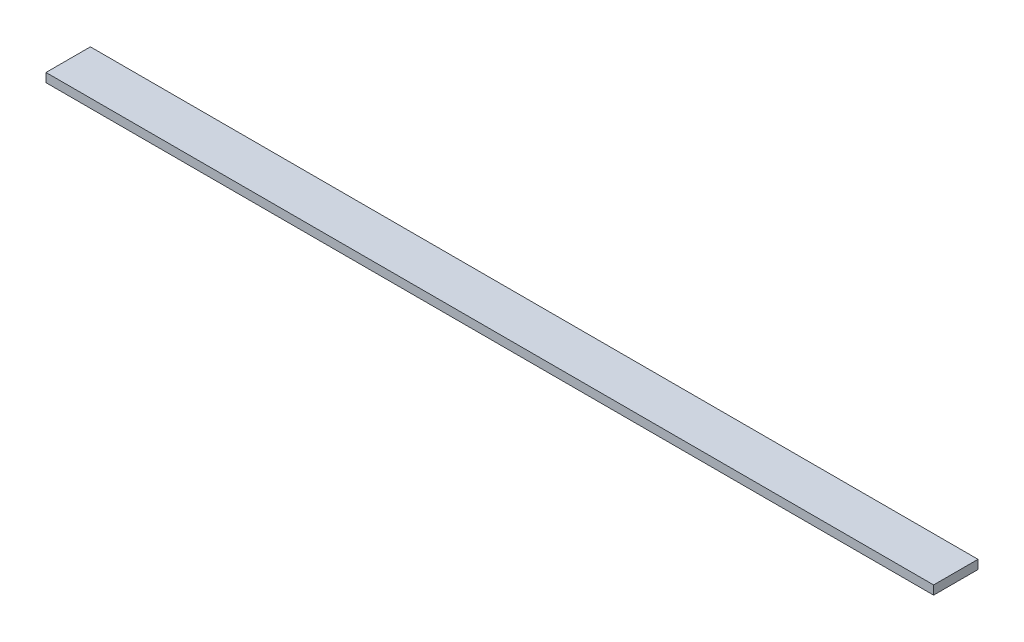
from build123d import *

# Parameters (mm, degrees)
SKETCH1_W           = 254
SKETCH1_H           = 12.7
BOSS_EXTRUDE1_DEPTH = 2.54


with BuildPart() as part:
    # Sketch1 → Boss-Extrude1 (new body)
    with BuildSketch(Plane(origin=(0, 0, 0), x_dir=(1, 0, 0), z_dir=(0, 1, 0))):
        Rectangle(SKETCH1_W, SKETCH1_H)
    extrude(amount=BOSS_EXTRUDE1_DEPTH)


solid = part.part
